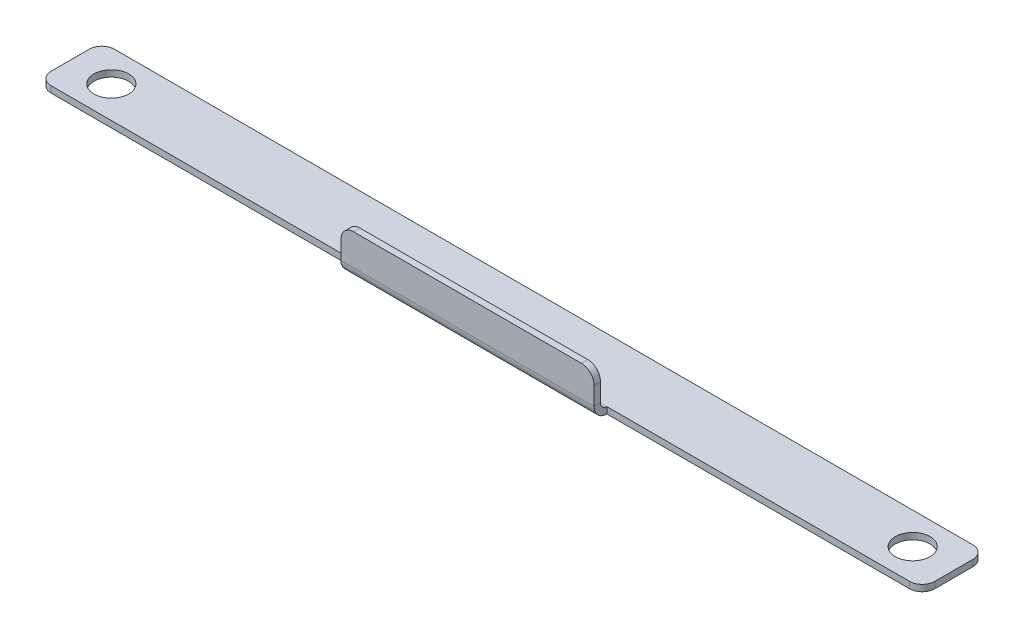
from build123d import *

# Parameters (mm, degrees)
SKETCH1_W            = 139.65
SKETCH1_H            = 10
BASE_FLANGE1_DEPTH   = 1.016
EDGE_FLANGE1_DEPTH   = 40
FILLET1_R            = 2
M5_CLEARANCE_HOLE1_D = 5.5


# Sheet-metal steps are written as plain solids
with BuildPart() as part:
    # Sketch1 → Base-Flange1 (new body)
    with BuildSketch(Plane(origin=(0, 0, 0), x_dir=(1, 0, 0), z_dir=(0, 1, 0))):
        with Locations((-57.025509978, 5)):
            Rectangle(SKETCH1_W, SKETCH1_H)
    extrude(amount=-BASE_FLANGE1_DEPTH)

    # Edge-Flange1 section (across the edge) → Edge-Flange1 (add)
    with BuildSketch(Plane(origin=(-77.025509978, 0, 1.016), x_dir=(0, 0, -1), z_dir=(1, 0, 0))):
        with BuildLine():
            Line((-1.016, 1.016), (-1.016, 5.94))
            Line((-1.016, 5.94), (0, 5.94))
            Line((0, 5.94), (0, 1.016))
            ThreePointArc((0, 1.016), (0.29757951, 0.29757951), (1.016, 0))
            Line((1.016, 0), (1.016, -1.016))
            ThreePointArc((1.016, -1.016), (-0.420840979, -0.420840979), (-1.016, 1.016))
        make_face()
    extrude(amount=EDGE_FLANGE1_DEPTH)

    # Fillet1
    fillet1_edges = [part.edges().sort_by_distance(p)[0] for p in [
        (-77.025509978, 5.94, 1.524),
        (-37.025509978, 5.94, 1.524),
        (-126.850509978, -0.508, -10),
        (12.799490022, -0.508, -10),
        (12.799490022, -0.508, 0),
        (-126.850509978, -0.508, 0),
    ]]
    fillet(fillet1_edges, radius=FILLET1_R)

    # M5 Clearance Hole1 (through all)
    with Locations(Plane(origin=(0, 0, 0), x_dir=(1, 0, 0), z_dir=(0, 1, 0))):
        with Locations((-120.350509978, 5), (6.299490022, 5)):
            Hole(M5_CLEARANCE_HOLE1_D / 2)


solid = part.part
